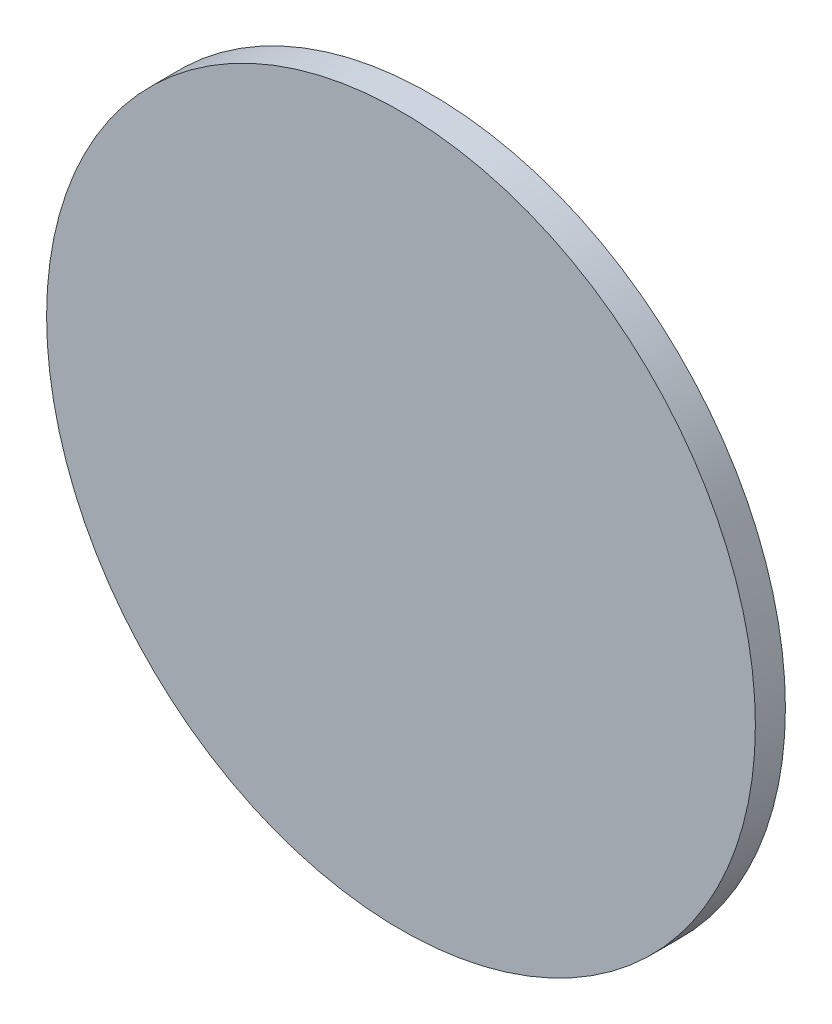
from build123d import *

# Parameters (mm, degrees)
SKETCH1_R           = 37.465
BOSS_EXTRUDE1_DEPTH = 3.175


with BuildPart() as part:
    # Sketch1 → Boss-Extrude1 (new body)
    with BuildSketch(Plane.XY):
        Circle(SKETCH1_R)
    extrude(amount=BOSS_EXTRUDE1_DEPTH)


solid = part.part
